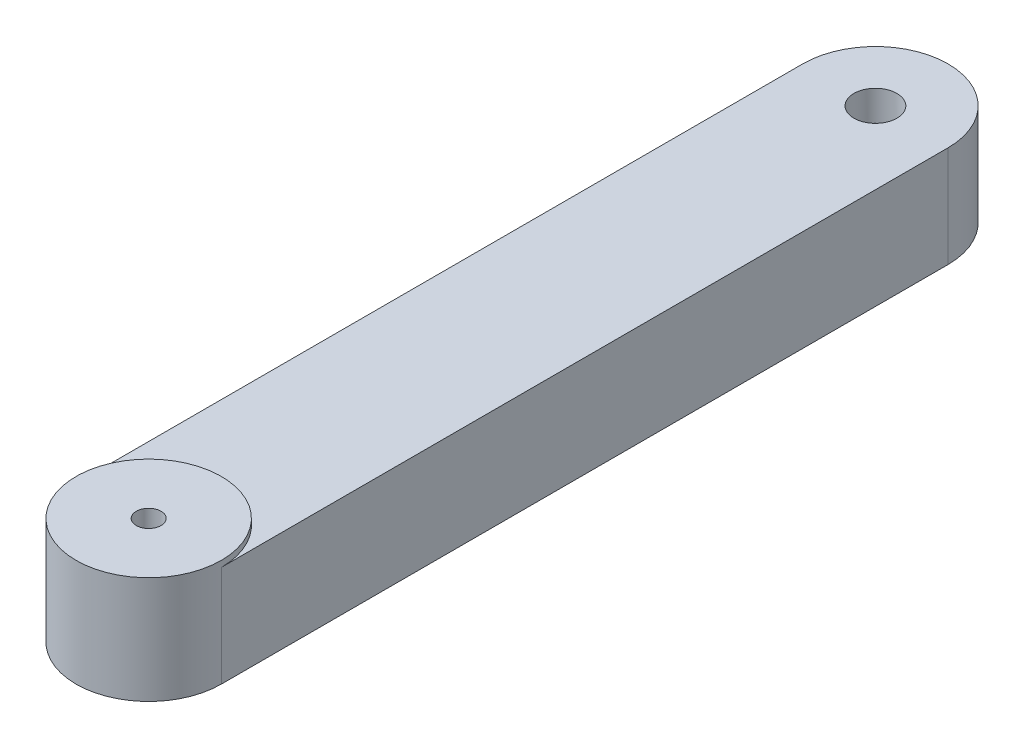
from build123d import *

# Parameters (mm, degrees)
SKETCH1_R           = 2.05
BOSS_EXTRUDE1_DEPTH = 17.7
SKETCH2_R           = 3.55
CUT_EXTRUDE1_DEPTH  = 6
CUT_EXTRUDE2_START  = -1
CUT_EXTRUDE2_DEPTH  = 1


with BuildPart() as part:
    # Sketch1 → Boss-Extrude1 (new body)
    with BuildSketch(Plane(origin=(0, 0, 0), x_dir=(1, 0, 0), z_dir=(0, 1, 0))):
        with BuildLine():
            Line((-12, -60), (-12, 60))
            ThreePointArc((-12, 60), (0, 72), (12, 60))
            Line((12, 60), (12, -60))
            ThreePointArc((12, -60), (0, -72), (-12, -60))
        make_face()
        with Locations((0, 60)):
            Circle(SKETCH1_R, mode=Mode.SUBTRACT)
        with Locations((0, -60)):
            Circle(SKETCH1_R, mode=Mode.SUBTRACT)
    extrude(amount=BOSS_EXTRUDE1_DEPTH)

    # Sketch2 → Cut-Extrude1 (cut)
    with BuildSketch(Plane(origin=(0, 17.7, 0), x_dir=(1, 0, 0), z_dir=(0, 1, 0))):
        with Locations((0, 60)):
            Circle(SKETCH2_R)
    extrude(amount=-CUT_EXTRUDE1_DEPTH, mode=Mode.SUBTRACT)

    # Sketch3 → Cut-Extrude2 (cut)
    with BuildSketch(Plane(origin=(0, 17.7, 0), x_dir=(1, 0, 0), z_dir=(0, 1, 0)).offset(CUT_EXTRUDE2_START)):
        with BuildLine():
            Line((12, -60), (12, 60))
            ThreePointArc((12, 60), (0, 72), (-12, 60))
            Line((-12, 60), (-12, -60))
            ThreePointArc((-12, -60), (0, -48), (12, -60))
        make_face()
    extrude(amount=CUT_EXTRUDE2_DEPTH, mode=Mode.SUBTRACT)


solid = part.part
